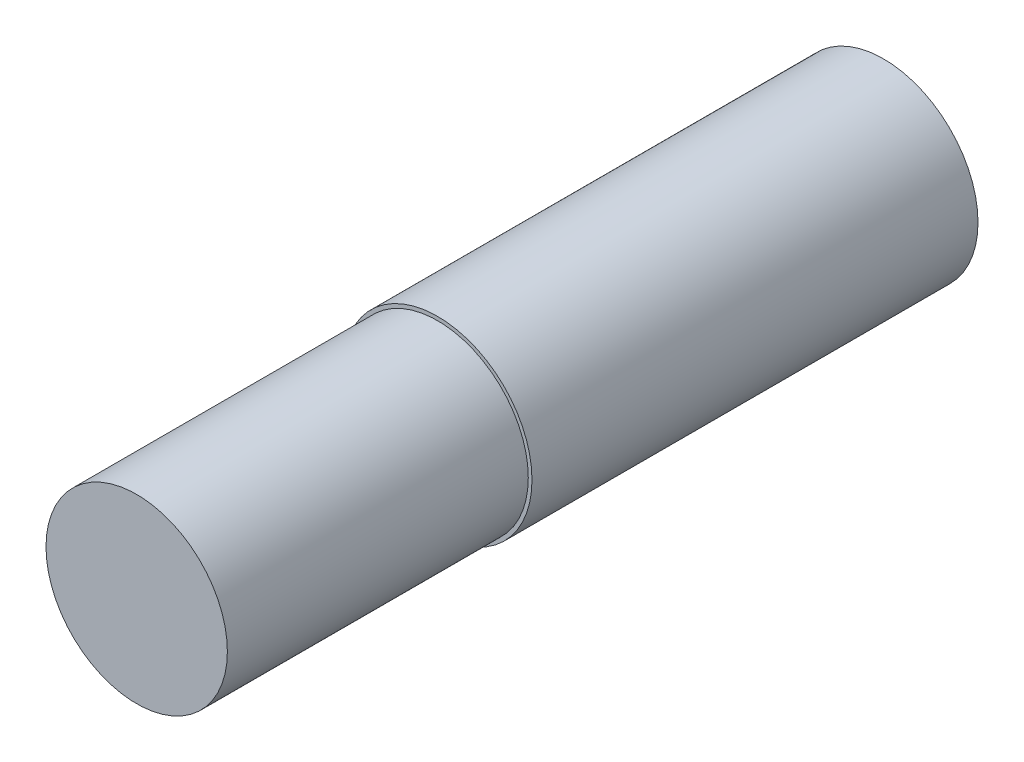
from build123d import *

# Parameters (mm, degrees)
SKETCH1_R           = 3.175
BOSS_EXTRUDE1_DEPTH = 15
SKETCH2_R           = 3.05
BOSS_EXTRUDE2_DEPTH = 10.12


with BuildPart() as part:
    # Sketch1 → Boss-Extrude1 (new body)
    with BuildSketch(Plane.XY):
        Circle(SKETCH1_R)
    extrude(amount=BOSS_EXTRUDE1_DEPTH)

    # Sketch2 → Boss-Extrude2 (add)
    with BuildSketch(Plane.XY.offset(15)):
        Circle(SKETCH2_R)
    extrude(amount=BOSS_EXTRUDE2_DEPTH)


solid = part.part
